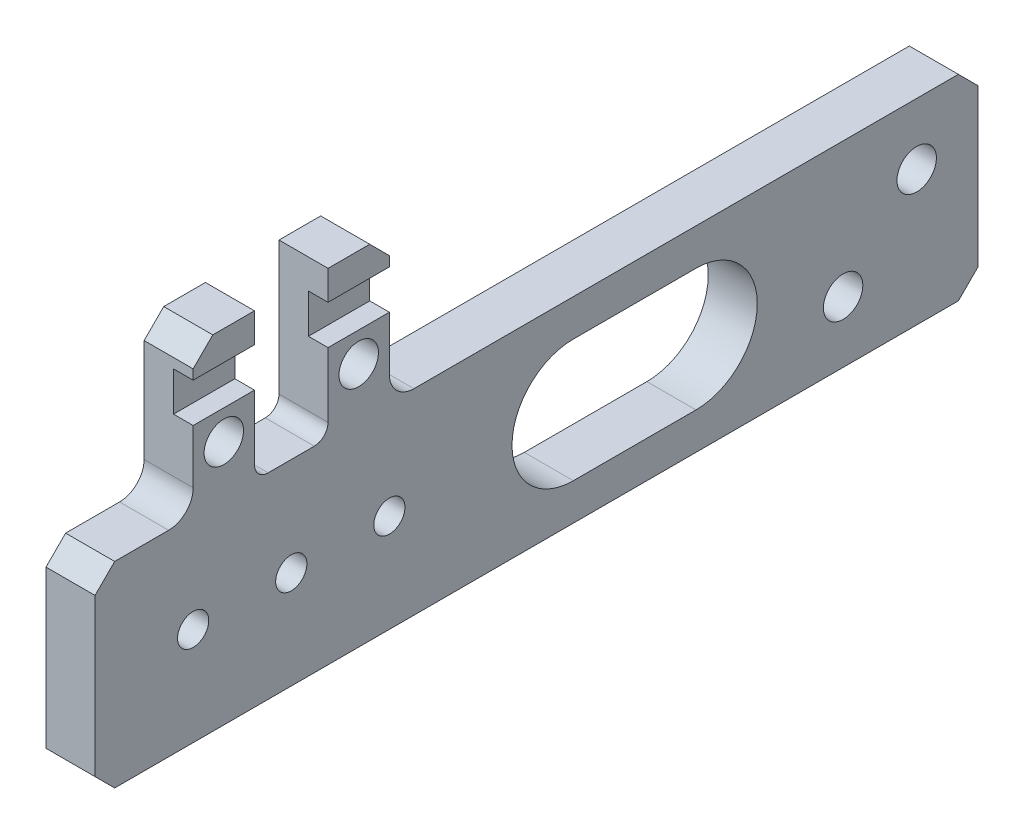
from build123d import *

# Parameters (mm, degrees)
BOSS_EXTRUDE1_DEPTH    = 6.35
F_10_32_TAPPED_HOLE1_D = 4.0386
F_10_CLEARANCE_HOLE1_D = 5.1054
SKETCH6_W              = 25.4
SKETCH6_H              = 5.08
CUT_EXTRUDE1_DEPTH     = 2.54
CHAMFER1_SIZE          = 2.54
CUT_EXTRUDE2_DEPTH     = 123.803155497


with BuildPart() as part:
    # Sketch1 → Boss-Extrude1 (new body)
    with BuildSketch(Plane(origin=(0, 0, 0), x_dir=(0, 0, -1), z_dir=(1, 0, 0))):
        with BuildLine():
            Line((0, 0), (114.3, 0))
            Line((114.3, 0), (114.3, 25.4))
            Line((114.3, 25.4), (41.275, 25.4))
            ThreePointArc((41.275, 25.4), (39.02993597, 26.32993597), (38.1, 28.575))
            Line((38.1, 28.575), (38.1, 44.45))
            Line((38.1, 44.45), (30.1625, 44.45))
            Line((30.1625, 44.45), (30.1625, 27.178))
            ThreePointArc((30.1625, 27.178), (29.641735857, 25.920764143), (28.3845, 25.4))
            Line((28.3845, 25.4), (22.4155, 25.4))
            ThreePointArc((22.4155, 25.4), (21.158264143, 25.920764143), (20.6375, 27.178))
            Line((20.6375, 27.178), (20.6375, 44.45))
            Line((20.6375, 44.45), (12.7, 44.45))
            Line((12.7, 44.45), (12.7, 28.575))
            ThreePointArc((12.7, 28.575), (11.77006403, 26.32993597), (9.525, 25.4))
            Line((9.525, 25.4), (0, 25.4))
            Line((0, 25.4), (0, 0))
        make_face()
    extrude(amount=BOSS_EXTRUDE1_DEPTH)

    # #10-32 Tapped Hole1 (through all)
    with Locations(Plane(origin=(6.35, 0, 0), x_dir=(0, 0, -1), z_dir=(1, 0, 0))):
        with Locations((12.7, 12.7), (25.4, 12.7), (38.1, 12.7)):
            Hole(F_10_32_TAPPED_HOLE1_D / 2)

    # #10 Clearance Hole1 (through all)
    with Locations(Plane(origin=(6.35, 0, 0), x_dir=(0, 0, -1), z_dir=(1, 0, 0))):
        with Locations((106.3625, 17.4625), (96.8375, 7.9375), (34.13125, 31.75), (16.66875, 31.75)):
            Hole(F_10_CLEARANCE_HOLE1_D / 2)

    # Sketch6 → Cut-Extrude1 (cut)
    with BuildSketch(Plane(origin=(6.35, 0, 0), x_dir=(0, 0, -1), z_dir=(1, 0, 0))):
        with Locations((25.4, 38.1)):
            Rectangle(SKETCH6_W, SKETCH6_H)
    extrude(amount=-CUT_EXTRUDE1_DEPTH, mode=Mode.SUBTRACT)

    # Chamfer1
    chamfer1_edges = [part.edges().sort_by_distance(p)[0] for p in [
        (3.175, 44.45, -38.1),
        (3.175, 44.45, -12.7),
        (3.175, 25.4, -114.3),
        (3.175, 0, -114.3),
        (3.175, 0, 0),
        (3.175, 25.4, 0),
    ]]
    chamfer(chamfer1_edges, length=CHAMFER1_SIZE)

    # Sketch7 → Cut-Extrude2 (cut, through all)
    with BuildSketch(Plane(origin=(6.35, 0, 0), x_dir=(0, 0, -1), z_dir=(1, 0, 0))):
        with BuildLine():
            Line((61.9125, 20.6375), (77.7875, 20.6375))
            ThreePointArc((77.7875, 20.6375), (85.725, 12.7), (77.7875, 4.7625))
            Line((77.7875, 4.7625), (61.9125, 4.7625))
            ThreePointArc((61.9125, 4.7625), (53.975, 12.7), (61.9125, 20.6375))
        make_face()
    extrude(amount=-CUT_EXTRUDE2_DEPTH, mode=Mode.SUBTRACT)


solid = part.part
